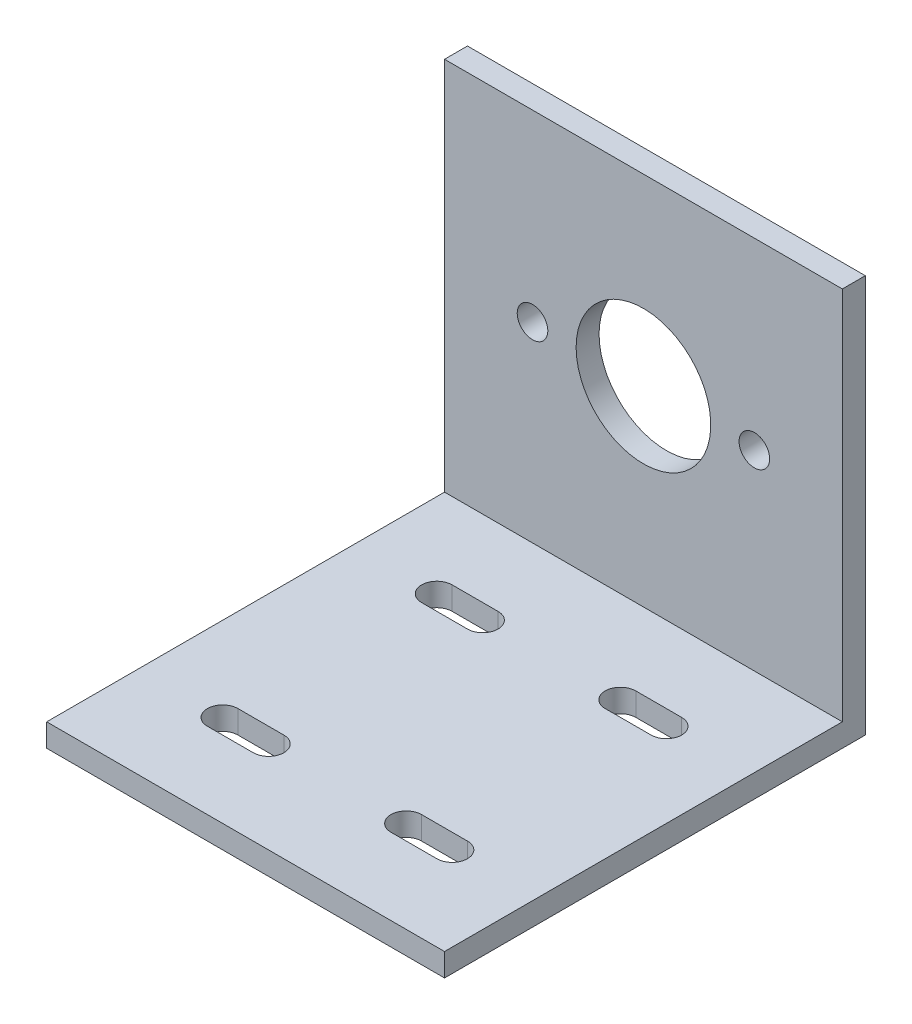
from build123d import *

# Parameters (mm, degrees)
SKETCH_1_W      = 52
SKETCH_1_H      = 52
EXTRUDE_1_DEPTH = 3
SKETCH_2_W      = 52
SKETCH_2_H      = 52
SKETCH_2_R      = 2
SKETCH_2_R_2    = 8.8
EXTRUDE_2_DEPTH = 3


with BuildPart() as part:
    # 草圖1 → 填料-伸長1 (new body)
    with BuildSketch(Plane(origin=(0, 0, 0), x_dir=(1, 0, 0), z_dir=(0, 1, 0))):
        Rectangle(SKETCH_1_W, SKETCH_1_H)
        with BuildLine():
            Line((-15, 16), (-9, 16))
            ThreePointArc((-9, 16), (-7, 14), (-9, 12))
            Line((-9, 12), (-15, 12))
            ThreePointArc((-15, 12), (-17, 14), (-15, 16))
        make_face(mode=Mode.SUBTRACT)
        with BuildLine():
            Line((15, 16), (9, 16))
            ThreePointArc((9, 16), (7, 14), (9, 12))
            Line((9, 12), (15, 12))
            ThreePointArc((15, 12), (17, 14), (15, 16))
        make_face(mode=Mode.SUBTRACT)
        with BuildLine():
            Line((15, -16), (9, -16))
            ThreePointArc((9, -16), (7, -14), (9, -12))
            Line((9, -12), (15, -12))
            ThreePointArc((15, -12), (17, -14), (15, -16))
        make_face(mode=Mode.SUBTRACT)
        with BuildLine():
            Line((-15, -16), (-9, -16))
            ThreePointArc((-9, -16), (-7, -14), (-9, -12))
            Line((-9, -12), (-15, -12))
            ThreePointArc((-15, -12), (-17, -14), (-15, -16))
        make_face(mode=Mode.SUBTRACT)
    extrude(amount=EXTRUDE_1_DEPTH)

    # 草圖2 → 填料-伸長2 (add)
    with BuildSketch(Plane(origin=(0, 0, -26), x_dir=(-1, 0, 0), z_dir=(0, 0, -1))):
        with Locations((0, 26)):
            Rectangle(SKETCH_2_W, SKETCH_2_H)
        with Locations((-14.5, 28)):
            Circle(SKETCH_2_R, mode=Mode.SUBTRACT)
        with Locations((14.5, 28)):
            Circle(SKETCH_2_R, mode=Mode.SUBTRACT)
        with Locations((0, 28)):
            Circle(SKETCH_2_R_2, mode=Mode.SUBTRACT)
    extrude(amount=EXTRUDE_2_DEPTH)


solid = part.part
